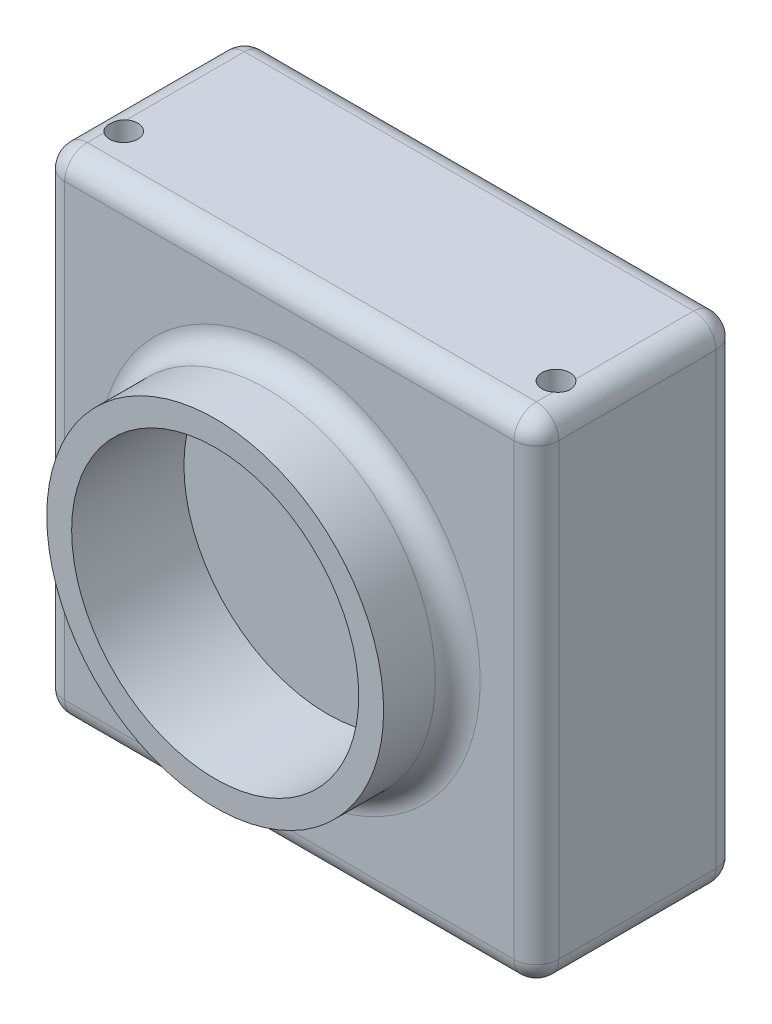
from build123d import *

# Parameters (mm, degrees)
SKETCH1_W             = 44
SKETCH1_H             = 44
BOSS_EXTRUDE1_DEPTH   = 18
SKETCH2_R             = 15
BOSS_EXTRUDE2_DEPTH   = 6.6
M3_TAPPED_HOLE1_D     = 2.5
M3_TAPPED_HOLE1_DEPTH = 7.5
M3_TAPPED_HOLE1_TIP   = 0.751075774
SKETCH5_R             = 4
BOSS_EXTRUDE3_DEPTH   = 3.4
FILLET2_R             = 2
SKETCH6_R             = 12.784207237
CUT_EXTRUDE1_DEPTH    = 10


with BuildPart() as part:
    # Sketch1 → Boss-Extrude1 (new body)
    with BuildSketch(Plane.XY):
        Rectangle(SKETCH1_W, SKETCH1_H)
    extrude(amount=BOSS_EXTRUDE1_DEPTH)

    # Sketch2 → Boss-Extrude2 (add)
    with BuildSketch(Plane.XY.offset(18)):
        Circle(SKETCH2_R)
    extrude(amount=BOSS_EXTRUDE2_DEPTH)

    # M3 Tapped Hole1
    with Locations(Plane(origin=(0, 22, 0), x_dir=(1, 0, 0), z_dir=(0, 1, 0))):
        with Locations((-19.25, -13.5), (19.25, -13.5)):
            Hole(M3_TAPPED_HOLE1_D / 2, depth=M3_TAPPED_HOLE1_DEPTH)
            with Locations((0, 0, -(M3_TAPPED_HOLE1_DEPTH + M3_TAPPED_HOLE1_TIP / 2))):  # 118° drill point
                Cone(0, M3_TAPPED_HOLE1_D / 2, M3_TAPPED_HOLE1_TIP, mode=Mode.SUBTRACT)

    # Sketch5 → Boss-Extrude3 (add)
    with BuildSketch(Plane(origin=(0, 0, 0), x_dir=(-1, 0, 0), z_dir=(0, 0, -1))):
        with Locations((0, -13)):
            Circle(SKETCH5_R)
    extrude(amount=BOSS_EXTRUDE3_DEPTH)

    # Fillet2
    # the kernel refuses this fillet: 2 mm, written as the material it adds along each edge
    with BuildSketch(Plane(origin=(0, 0, 18), x_dir=(1, 0, 0), z_dir=(0, -1, 0))) as fillet2_piece_1:
        with BuildLine():
            CenterArc((15 + FILLET2_R, FILLET2_R), FILLET2_R, 180, 90)
            Line((15, FILLET2_R), (15, 0))
            Line((15, 0), (15 + FILLET2_R, 0))
        make_face()
    revolve(axis=Axis((0, 0, 18), (0, 0, 1)))
    # the kernel refuses this fillet: 2 mm, written as the material it takes off along each edge
    with BuildSketch(Plane(origin=(-20, 20, 16), x_dir=(0, 0, 1), z_dir=(-1, 0, 0))) as fillet2_2_piece_1_section:
        Polygon((0, 0), (FILLET2_R, 0), (FILLET2_R, FILLET2_R), (0, FILLET2_R), align=None)
    fillet2_2_piece_1 = extrude(amount=FILLET2_R, mode=Mode.PRIVATE)
    fillet2_2_piece_1 = fillet2_2_piece_1 - Plane(origin=(-20, 20, 16), x_dir=(0, -0.7071067811865475, -0.7071067811865475), z_dir=(-1, 0, 0)) * Sphere(FILLET2_R, mode=Mode.PRIVATE)
    add(fillet2_2_piece_1, mode=Mode.SUBTRACT)
    with BuildSketch(Plane(origin=(-20, -20, 16), x_dir=(-1, 0, 0), z_dir=(0, -1, 0))) as fillet2_2_piece_2_section:
        Polygon((0, 0), (FILLET2_R, 0), (FILLET2_R, -FILLET2_R), (0, -FILLET2_R), align=None)
    fillet2_2_piece_2 = extrude(amount=FILLET2_R, mode=Mode.PRIVATE)
    fillet2_2_piece_2 = fillet2_2_piece_2 - Plane(origin=(-20, -20, 16), x_dir=(0.7071067811865475, 0, -0.7071067811865475), z_dir=(0, -1, 0)) * Sphere(FILLET2_R, mode=Mode.PRIVATE)
    add(fillet2_2_piece_2, mode=Mode.SUBTRACT)
    with BuildSketch(Plane(origin=(20, -20, 16), x_dir=(1, 0, 0), z_dir=(0, -1, 0))) as fillet2_2_piece_3_section:
        Polygon((0, 0), (FILLET2_R, 0), (FILLET2_R, FILLET2_R), (0, FILLET2_R), align=None)
    fillet2_2_piece_3 = extrude(amount=FILLET2_R, mode=Mode.PRIVATE)
    fillet2_2_piece_3 = fillet2_2_piece_3 - Plane(origin=(20, -20, 16), x_dir=(-0.7071067811865475, 0, -0.7071067811865475), z_dir=(0, -1, 0)) * Sphere(FILLET2_R, mode=Mode.PRIVATE)
    add(fillet2_2_piece_3, mode=Mode.SUBTRACT)
    with BuildSketch(Plane(origin=(20, 20, 16), x_dir=(0, 0, 1), z_dir=(1, 0, 0))) as fillet2_2_piece_4_section:
        Polygon((0, 0), (FILLET2_R, 0), (FILLET2_R, -FILLET2_R), (0, -FILLET2_R), align=None)
    fillet2_2_piece_4 = extrude(amount=FILLET2_R, mode=Mode.PRIVATE)
    fillet2_2_piece_4 = fillet2_2_piece_4 - Plane(origin=(20, 20, 16), x_dir=(0, -0.7071067811865475, -0.7071067811865475), z_dir=(1, 0, 0)) * Sphere(FILLET2_R, mode=Mode.PRIVATE)
    add(fillet2_2_piece_4, mode=Mode.SUBTRACT)
    with BuildSketch(Plane(origin=(-20, -20, 2), x_dir=(-1, 0, 0), z_dir=(0, -1, 0))) as fillet2_2_piece_5_section:
        Polygon((0, 0), (FILLET2_R, 0), (FILLET2_R, FILLET2_R), (0, FILLET2_R), align=None)
    fillet2_2_piece_5 = extrude(amount=FILLET2_R, mode=Mode.PRIVATE)
    fillet2_2_piece_5 = fillet2_2_piece_5 - Plane(origin=(-20, -20, 2), x_dir=(0.7071067811865475, 0, 0.7071067811865475), z_dir=(0, -1, 0)) * Sphere(FILLET2_R, mode=Mode.PRIVATE)
    add(fillet2_2_piece_5, mode=Mode.SUBTRACT)
    with BuildSketch(Plane(origin=(20, -20, 2), x_dir=(1, 0, 0), z_dir=(0, -1, 0))) as fillet2_2_piece_6_section:
        Polygon((0, 0), (FILLET2_R, 0), (FILLET2_R, -FILLET2_R), (0, -FILLET2_R), align=None)
    fillet2_2_piece_6 = extrude(amount=FILLET2_R, mode=Mode.PRIVATE)
    fillet2_2_piece_6 = fillet2_2_piece_6 - Plane(origin=(20, -20, 2), x_dir=(-0.7071067811865475, 0, 0.7071067811865475), z_dir=(0, -1, 0)) * Sphere(FILLET2_R, mode=Mode.PRIVATE)
    add(fillet2_2_piece_6, mode=Mode.SUBTRACT)
    with BuildSketch(Plane(origin=(-20, 20, 2), x_dir=(0, 0, -1), z_dir=(-1, 0, 0))) as fillet2_2_piece_7_section:
        Polygon((0, 0), (FILLET2_R, 0), (FILLET2_R, -FILLET2_R), (0, -FILLET2_R), align=None)
    fillet2_2_piece_7 = extrude(amount=FILLET2_R, mode=Mode.PRIVATE)
    fillet2_2_piece_7 = fillet2_2_piece_7 - Plane(origin=(-20, 20, 2), x_dir=(0, -0.7071067811865475, 0.7071067811865475), z_dir=(-1, 0, 0)) * Sphere(FILLET2_R, mode=Mode.PRIVATE)
    add(fillet2_2_piece_7, mode=Mode.SUBTRACT)
    with BuildSketch(Plane(origin=(20, 20, 2), x_dir=(0, 0, -1), z_dir=(1, 0, 0))) as fillet2_2_piece_8_section:
        Polygon((0, 0), (FILLET2_R, 0), (FILLET2_R, FILLET2_R), (0, FILLET2_R), align=None)
    fillet2_2_piece_8 = extrude(amount=FILLET2_R, mode=Mode.PRIVATE)
    fillet2_2_piece_8 = fillet2_2_piece_8 - Plane(origin=(20, 20, 2), x_dir=(0, -0.7071067811865475, 0.7071067811865475), z_dir=(1, 0, 0)) * Sphere(FILLET2_R, mode=Mode.PRIVATE)
    add(fillet2_2_piece_8, mode=Mode.SUBTRACT)
    with BuildSketch(Plane(origin=(-22, 20, 18), x_dir=(0, 0, -1), z_dir=(0, -1, 0)), Plane(origin=(-20, -22, 18), x_dir=(0, 0, -1), z_dir=(1, 0, 0)), Plane(origin=(22, -20, 18), x_dir=(0, 0, -1), z_dir=(0, 1, 0)), Plane(origin=(20, 22, 0), x_dir=(0, -1, 0), z_dir=(-1, 0, 0))) as fillet2_2_piece_9:
        with BuildLine():
            CenterArc((FILLET2_R, FILLET2_R), FILLET2_R, 180, 90)
            Line((0, FILLET2_R), (0, 0))
            Line((0, 0), (FILLET2_R, 0))
        make_face()
    extrude(amount=40, mode=Mode.SUBTRACT)
    with BuildSketch(Plane(origin=(-20, -22, 0), x_dir=(0, 0, 1), z_dir=(1, 0, 0)), Plane(origin=(-22, 20, 0), x_dir=(0, 0, 1), z_dir=(0, -1, 0)), Plane(origin=(22, -20, 0), x_dir=(0, 0, 1), z_dir=(0, 1, 0)), Plane(origin=(20, 22, 18), x_dir=(0, -1, 0), z_dir=(-1, 0, 0))) as fillet2_2_piece_10:
        with BuildLine():
            CenterArc((FILLET2_R, -FILLET2_R), FILLET2_R, 90, 90)
            Line((0, -FILLET2_R), (0, 0))
            Line((0, 0), (FILLET2_R, 0))
        make_face()
    extrude(amount=40, mode=Mode.SUBTRACT)
    with BuildSketch(Plane(origin=(22, -22, 2), x_dir=(-1, 0, 0), z_dir=(0, 0, 1)), Plane(origin=(22, 22, 2), x_dir=(0, -1, 0), z_dir=(0, 0, 1))) as fillet2_2_piece_11:
        with BuildLine():
            CenterArc((FILLET2_R, -FILLET2_R), FILLET2_R, 90, 90)
            Line((0, -FILLET2_R), (0, 0))
            Line((0, 0), (FILLET2_R, 0))
        make_face()
    extrude(amount=14, mode=Mode.SUBTRACT)
    with BuildSketch(Plane(origin=(-22, -22, 2), x_dir=(1, 0, 0), z_dir=(0, 0, 1)), Plane(origin=(-22, 22, 2), x_dir=(0, -1, 0), z_dir=(0, 0, 1))) as fillet2_2_piece_12:
        with BuildLine():
            CenterArc((FILLET2_R, FILLET2_R), FILLET2_R, 180, 90)
            Line((0, FILLET2_R), (0, 0))
            Line((0, 0), (FILLET2_R, 0))
        make_face()
    extrude(amount=14, mode=Mode.SUBTRACT)

    # Sketch6 → Cut-Extrude1 (cut)
    with BuildSketch(Plane.XY.offset(24.6)):
        Circle(SKETCH6_R)
    extrude(amount=-CUT_EXTRUDE1_DEPTH, mode=Mode.SUBTRACT)


solid = part.part
